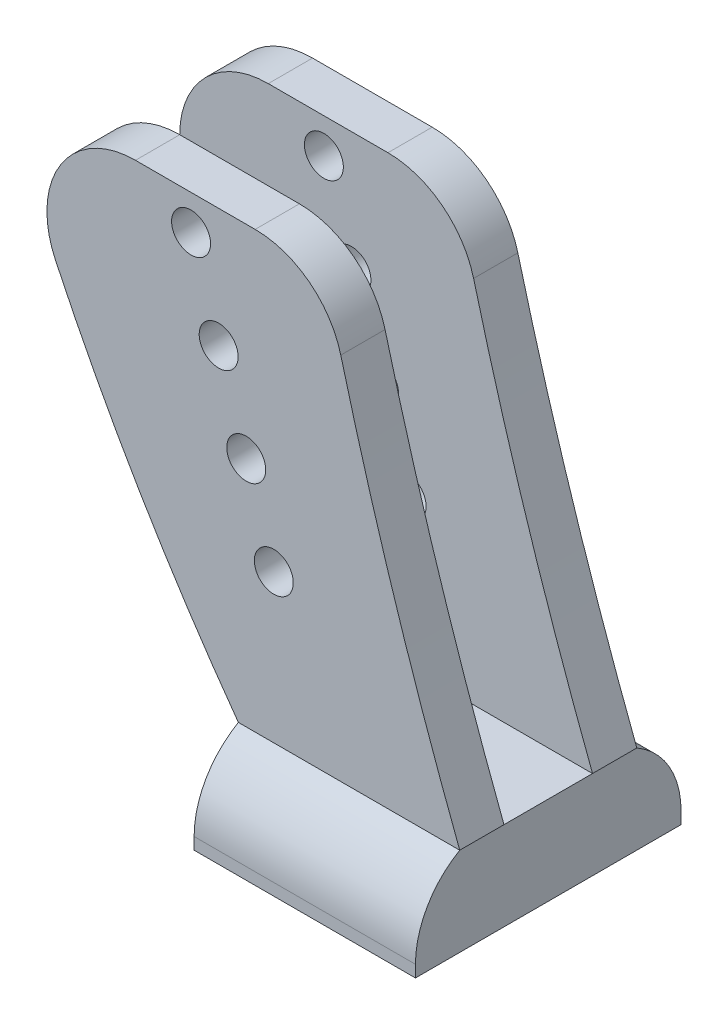
from build123d import *

# Parameters (mm, degrees)
SKETCH1_W           = 12.5
SKETCH1_H           = 15
BOSS_EXTRUDE1_DEPTH = 5
SKETCH12_R          = 1.1
BOSS_EXTRUDE3_DEPTH = 10
CUT_EXTRUDE2_REACH  = 38.305
SKETCH13_W          = 40
SKETCH13_H          = 5
FILLET2_R           = 5


with BuildPart() as part:
    # Sketch1 → Boss-Extrude1 (new body)
    with BuildSketch(Plane(origin=(0, 0, 0), x_dir=(1, 0, 0), z_dir=(0, 1, 0))):
        Rectangle(SKETCH1_W, SKETCH1_H)
    extrude(amount=BOSS_EXTRUDE1_DEPTH)

    # Sketch12 → Boss-Extrude3 (add)
    with BuildSketch(Plane(origin=(0, 0, -5), x_dir=(-1, 0, 0), z_dir=(0, 0, -1))):
        with BuildLine():
            Line((19.657908058, 29.586368397), (1.407908058, 29.586368397))
            ThreePointArc((1.407908058, 29.586368397), (-2.024927187, 17.169805211), (-6.25, 5))
            Line((-6.25, 5), (6.25, 5))
            ThreePointArc((6.25, 5), (13.739573521, 16.86475517), (19.657908058, 29.586368397))
        make_face()
        with Locations((4.249543893, 13.369198977)):
            Circle(SKETCH12_R, mode=Mode.SUBTRACT)
        with Locations((5.806784348, 18.120514812)):
            Circle(SKETCH12_R, mode=Mode.SUBTRACT)
        with Locations((7.364024803, 22.871830647)):
            Circle(SKETCH12_R, mode=Mode.SUBTRACT)
        with Locations((8.921265258, 27.623146482)):
            Circle(SKETCH12_R, mode=Mode.SUBTRACT)
    extrude(amount=-BOSS_EXTRUDE3_DEPTH)

    # Cut-Extrude2: up to this face of the body (flat: up to its plane)
    cut_extrude2_end = Plane(part.part.faces().sort_by_distance((0, 5, 6.25))[0])
    # Sketch13 → Cut-Extrude2 (cut, up to the picked face)
    with BuildSketch(Plane(origin=(0, 29.586368397, 0), x_dir=(1, 0, 0), z_dir=(0, 1, 0)), mode=Mode.PRIVATE) as cut_extrude2_sk1:
        Rectangle(SKETCH13_W, SKETCH13_H)
    cut_extrude2_tool1 = split(extrude(cut_extrude2_sk1.sketch, amount=-CUT_EXTRUDE2_REACH, mode=Mode.PRIVATE), bisect_by=cut_extrude2_end, keep=Keep.BOTH, mode=Mode.PRIVATE)
    add(cut_extrude2_tool1.solids().sort_by(Axis((0, 29.586368, 0), (0, -1, 0)))[0], mode=Mode.SUBTRACT)

    # Fillet2
    # the kernel refuses this fillet: 5 mm, written as the material it takes off along each edge
    with BuildSketch(Plane(origin=(-19.657908058, 29.586368397, -16.938005308), x_dir=(0.3958255754909857, -0.9183257122542251, 0), z_dir=(0, 0, 1)), Plane(origin=(-19.657908058, 29.586368397, -24.438005308), x_dir=(0.3958255754909857, -0.9183257122542251, 0), z_dir=(0, 0, 1))) as fillet2_piece_1:
        with BuildLine():
            CenterArc((7.598492984, 4.996876412), FILLET2_R, 156.682526959, 115.342832392)
            Line((3.006864423, 6.97600429), (2.915031851, 7.015586847))
            Line((2.915031851, 7.015586847), (-0.091832571, 0.039582558))
            Line((-0.091832571, 0.039582558), (-0.003534183, -0.099937528))
            ThreePointArc((-0.003534183, -0.099937528), (3.887601062, -0.168718929), (7.778736306, -0.099937528))
            Line((7.778736306, -0.099937528), (7.775202123, 0))
        make_face()
    extrude(amount=41.376010616, mode=Mode.SUBTRACT)
    with BuildSketch(Plane(origin=(-1.407908058, 29.586368397, -7.237373954), x_dir=(0.2446328232402741, -0.96961579081278, 0), z_dir=(0, 0, 1)), Plane(origin=(-1.407908058, 29.586368397, -14.737373954), x_dir=(0.2446328232402737, -0.9696157908127802, 0), z_dir=(0, 0, 1))) as fillet2_piece_2:
        with BuildLine():
            CenterArc((3.895246442, -4.999768735), FILLET2_R, 90.551073141, 75.28879109)
            Line((-0.952832513, -3.776604619), (-1.049794092, -3.752141336))
            Line((-1.049794092, -3.752141336), (-0.096961579, 0.024463282))
            Line((-0.096961579, 0.024463282), (0.000961789, 0.099995375))
            ThreePointArc((0.000961789, 0.099995375), (1.92357849, 0.090749401), (3.84619519, 0.099995375))
            Line((3.84619519, 0.099995375), (3.847156979, 0))
        make_face()
    extrude(amount=21.974747908, mode=Mode.SUBTRACT)
    with BuildSketch(Plane(origin=(17.075317547, 5, -7.5), x_dir=(0, -1, 0), z_dir=(-1, 0, 0)), Plane(origin=(-17.075317547, 5, 7.5), x_dir=(0, -1, 0), z_dir=(1, 0, 0))) as fillet2_piece_3:
        with BuildLine():
            CenterArc((4.330127019, 5), FILLET2_R, 210, 60)
            Line((0, 2.5), (-0.08660254, 2.45))
            ThreePointArc((-0.08660254, 2.45), (-0.1, 1.25), (-0.1, 0))
            Line((-0.1, 0), (0, -0.1))
            Line((0, -0.1), (4.330127019, -0.1))
            Line((4.330127019, -0.1), (4.330127019, 0))
        make_face()
    extrude(amount=34.150635095, mode=Mode.SUBTRACT)


solid = part.part
